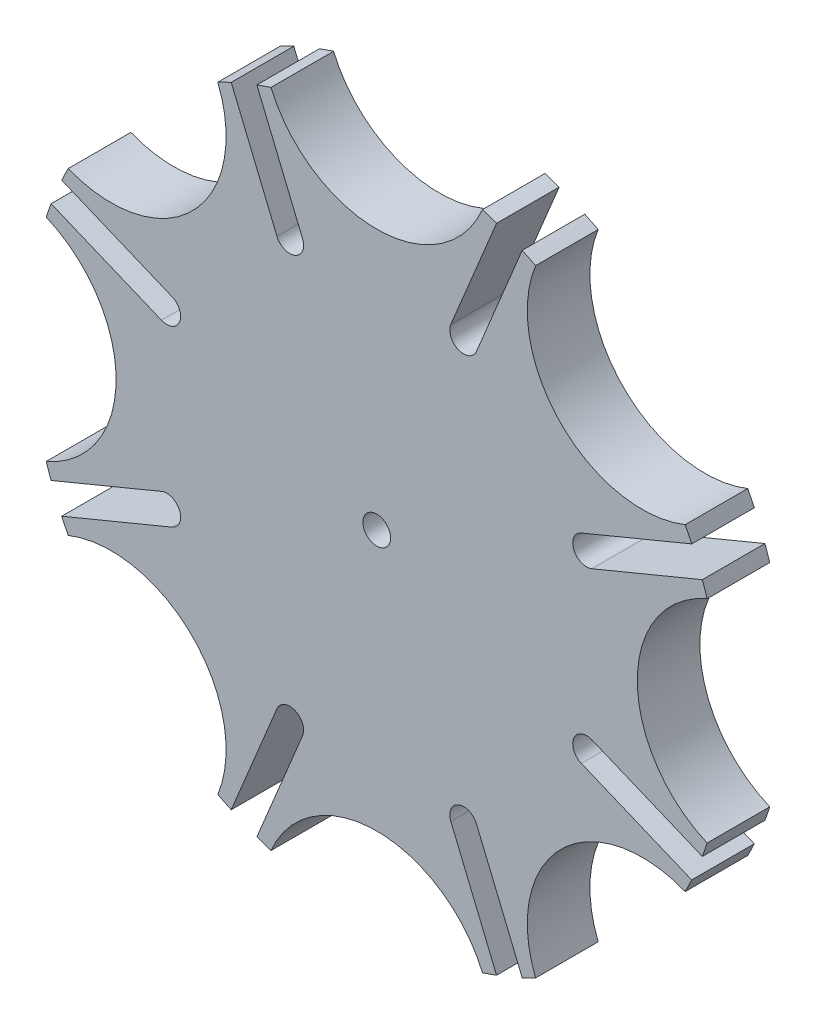
from build123d import *

# Parameters (mm, degrees)
CROQUIS1_R              = 0.665193263
SALIENTE_EXTRUIR1_DEPTH = 3


with BuildPart() as part:
    # Croquis1 → Saliente-Extruir1 (new body)
    with BuildSketch(Plane.XY):
        with BuildLine():
            ThreePointArc((-9.805994702, 4.781775998), (-9.445994702, 4.421775998), (-9.445994702, 3.912659116))
            ThreePointArc((-9.445994702, 3.912659116), (-9.805994702, 3.552659116), (-10.315111585, 3.552659116))
            Line((-10.315111585, 3.552659116), (-15.606200384, 5.744371864))
            ThreePointArc((-15.606200385, 5.744371864), (-15.725950119, 5.407937815), (-15.838448045, 5.06900997))
            ThreePointArc((-15.838448045, 5.06900997), (-12.489358574, 0), (-15.838448045, -5.06900997))
            ThreePointArc((-15.838448045, -5.06900997), (-15.725960944, -5.407906335), (-15.606223383, -5.744309383))
            Line((-15.606223383, -5.744309383), (-10.315111585, -3.552659116))
            ThreePointArc((-10.315111585, -3.552659116), (-9.445994702, -3.912659116), (-9.805994702, -4.781775998))
            Line((-9.805994702, -4.781775998), (-15.0971065, -6.973426265))
            ThreePointArc((-15.0971065, -6.973426265), (-14.943900866, -7.295966383), (-14.78380534, -7.615142693))
            ThreePointArc((-14.78380534, -7.615142693), (-8.83131014, -8.83131014), (-7.615142693, -14.78380534))
            ThreePointArc((-7.615142693, -14.78380534), (-7.295966383, -14.943900866), (-6.973426265, -15.0971065))
            Line((-6.973426265, -15.0971065), (-4.781775998, -9.805994702))
            ThreePointArc((-4.781775998, -9.805994702), (-3.912659116, -9.445994702), (-3.552659116, -10.315111585))
            Line((-3.552659116, -10.315111585), (-5.744309383, -15.606223383))
            ThreePointArc((-5.744309383, -15.606223383), (-5.407906335, -15.725960944), (-5.06900997, -15.838448045))
            ThreePointArc((-5.06900997, -15.838448045), (0, -12.489358574), (5.06900997, -15.838448045))
            ThreePointArc((5.06900997, -15.838448045), (5.407906335, -15.725960944), (5.744309383, -15.606223383))
            Line((5.744309383, -15.606223383), (3.552659116, -10.315111585))
            ThreePointArc((3.552659116, -10.315111585), (3.912659116, -9.445994702), (4.781775998, -9.805994702))
            Line((4.781775998, -9.805994702), (6.973426265, -15.0971065))
            ThreePointArc((6.973426265, -15.0971065), (7.295966383, -14.943900866), (7.615142693, -14.78380534))
            ThreePointArc((7.615142693, -14.78380534), (8.83131014, -8.83131014), (14.78380534, -7.615142693))
            ThreePointArc((14.78380534, -7.615142693), (14.943900866, -7.295966383), (15.0971065, -6.973426265))
            Line((15.0971065, -6.973426265), (9.805994702, -4.781775998))
            ThreePointArc((9.805994702, -4.781775998), (9.445994702, -3.912659116), (10.315111585, -3.552659116))
            Line((10.315111585, -3.552659116), (15.606223383, -5.744309383))
            ThreePointArc((15.606223383, -5.744309383), (15.725960944, -5.407906335), (15.838448045, -5.06900997))
            ThreePointArc((15.838448045, -5.06900997), (12.489358574, 0), (15.838448045, 5.06900997))
            ThreePointArc((15.838448045, 5.06900997), (15.725960944, 5.407906335), (15.606223383, 5.744309383))
            Line((15.606223383, 5.744309383), (10.315111585, 3.552659116))
            ThreePointArc((10.315111585, 3.552659116), (9.445994702, 3.912659116), (9.805994702, 4.781775998))
            Line((9.805994702, 4.781775998), (15.0971065, 6.973426265))
            ThreePointArc((15.0971065, 6.973426265), (14.943900866, 7.295966383), (14.78380534, 7.615142693))
            ThreePointArc((14.78380534, 7.615142693), (8.83131014, 8.83131014), (7.615142693, 14.78380534))
            ThreePointArc((7.615142693, 14.78380534), (7.295966383, 14.943900866), (6.973426265, 15.0971065))
            Line((6.973426265, 15.0971065), (4.781775998, 9.805994702))
            ThreePointArc((4.781775998, 9.805994702), (3.912659116, 9.445994702), (3.552659116, 10.315111585))
            Line((3.552659116, 10.315111585), (5.744309383, 15.606223383))
            ThreePointArc((5.744309383, 15.606223383), (5.407906335, 15.725960944), (5.06900997, 15.838448045))
            ThreePointArc((5.06900997, 15.838448045), (0, 12.489358574), (-5.06900997, 15.838448045))
            ThreePointArc((-5.06900997, 15.838448045), (-5.407906335, 15.725960944), (-5.744309383, 15.606223383))
            Line((-5.744309383, 15.606223383), (-3.552659116, 10.315111585))
            ThreePointArc((-3.552659116, 10.315111585), (-3.912659116, 9.445994702), (-4.781775998, 9.805994702))
            Line((-4.781775998, 9.805994702), (-6.973426265, 15.0971065))
            ThreePointArc((-6.973426265, 15.0971065), (-7.295966383, 14.943900866), (-7.615142693, 14.78380534))
            ThreePointArc((-7.615142693, 14.78380534), (-8.83131014, 8.83131014), (-14.78380534, 7.615142693))
            ThreePointArc((-14.78380534, 7.615142693), (-14.943915471, 7.295936468), (-15.097134419, 6.973365822))
            Line((-15.097134419, 6.973365822), (-9.805994702, 4.781775998))
        make_face()
        Circle(CROQUIS1_R, mode=Mode.SUBTRACT)
    extrude(amount=-SALIENTE_EXTRUIR1_DEPTH)


solid = part.part
